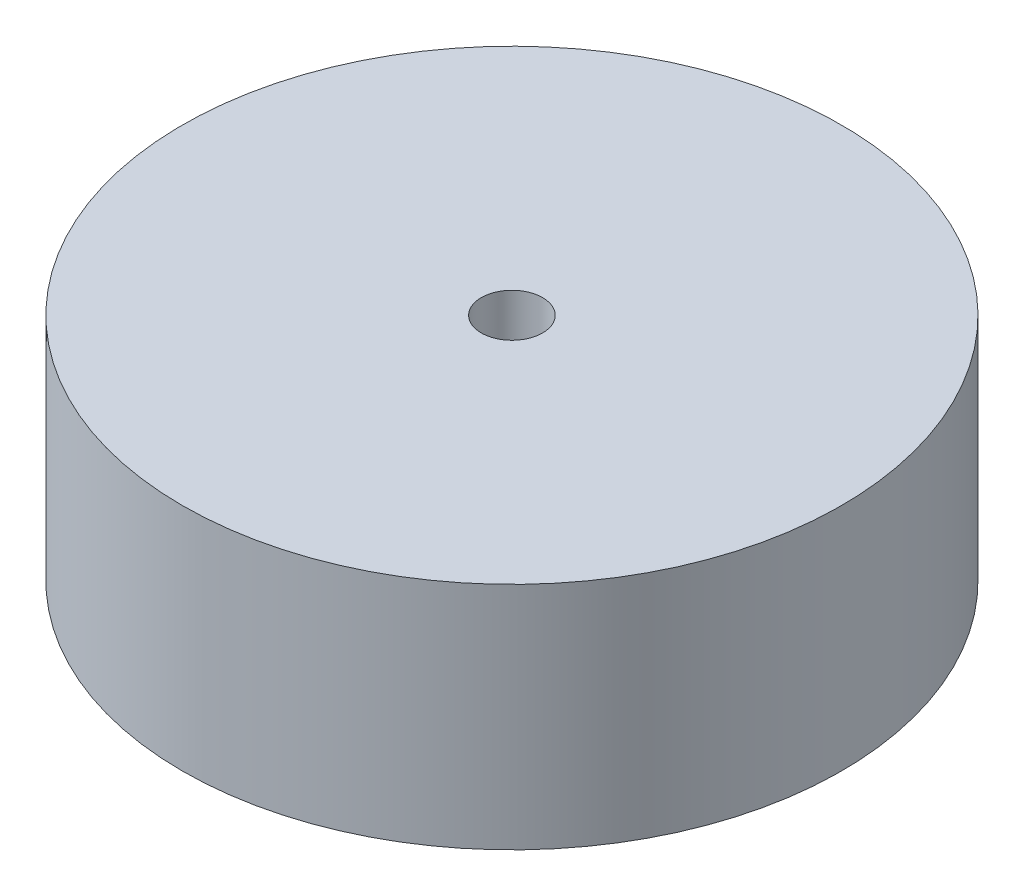
from build123d import *

# Parameters (mm, degrees)
SKETCH1_R               = 21.5
BOSS_EXTRUDE1_DEPTH     = 15
CUT_EXTRUDE1_DEPTH      = 26
CUT_EXTRUDE1_DEPTH_BACK = 9
SKETCH2_R               = 2


with BuildPart() as part:
    # Sketch1 → Boss-Extrude1 (new body)
    with BuildSketch(Plane(origin=(0, 0, 0), x_dir=(1, 0, 0), z_dir=(0, 1, 0))):
        Circle(SKETCH1_R)
    extrude(amount=BOSS_EXTRUDE1_DEPTH)

    # Sketch2 → Cut-Extrude1 (cut, two sides: drawn at the far end of the back side and taken through both)
    with BuildSketch(Plane(origin=(0, 0, 0), x_dir=(1, 0, 0), z_dir=(0, 1, 0)).offset(-CUT_EXTRUDE1_DEPTH_BACK)):
        Circle(SKETCH2_R)
    extrude(amount=CUT_EXTRUDE1_DEPTH + CUT_EXTRUDE1_DEPTH_BACK, mode=Mode.SUBTRACT)


solid = part.part
